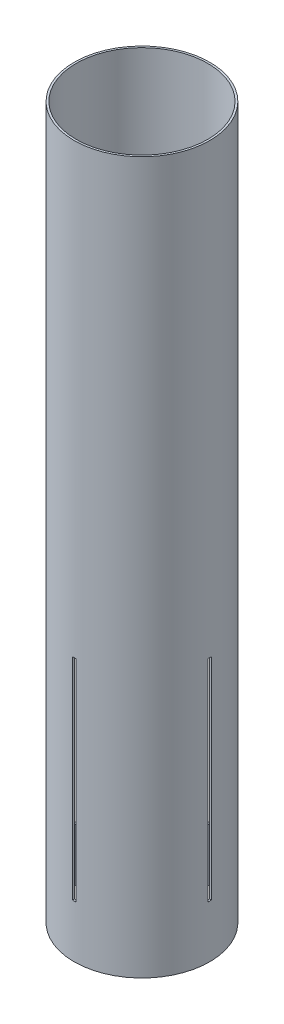
from build123d import *

# Parameters (mm, degrees)
SKETCH1_R           = 65.405
SKETCH1_R_2         = 63.5
BOSS_EXTRUDE1_DEPTH = 342.9
SKETCH4_W           = 3.175
SKETCH4_H           = 203.2
CUT_EXTRUDE2_DEPTH  = 356.156357187
CIRPATTERN4_COUNT   = 2
CIRPATTERN4_ANGLE   = 90


with BuildPart() as part:
    # Sketch1 → Boss-Extrude1 (new, symmetric)
    with BuildSketch(Plane(origin=(0, 0, 0), x_dir=(1, 0, 0), z_dir=(0, 1, 0))):
        Circle(SKETCH1_R)
        Circle(SKETCH1_R_2, mode=Mode.SUBTRACT)
    extrude(amount=BOSS_EXTRUDE1_DEPTH, both=True)

    # Sketch4 → Cut-Extrude2 (cut, symmetric)
    with BuildSketch(Plane(origin=(0, 0, 0), x_dir=(0, 0, -1), z_dir=(1, 0, 0))):
        with Locations((0, -190.5)):
            Rectangle(SKETCH4_W, SKETCH4_H)
    cut_extrude2 = extrude(amount=CUT_EXTRUDE2_DEPTH, both=True, mode=Mode.SUBTRACT)

    # CirPattern4: Cut-Extrude2 ×2 about axis
    cirpattern4_axis = Axis((0, 342.9, 0), (0, 1, 0))
    for i in range(1, CIRPATTERN4_COUNT):
        add(cut_extrude2.rotate(cirpattern4_axis, i * CIRPATTERN4_ANGLE / (CIRPATTERN4_COUNT - 1)), mode=Mode.SUBTRACT)


solid = part.part
